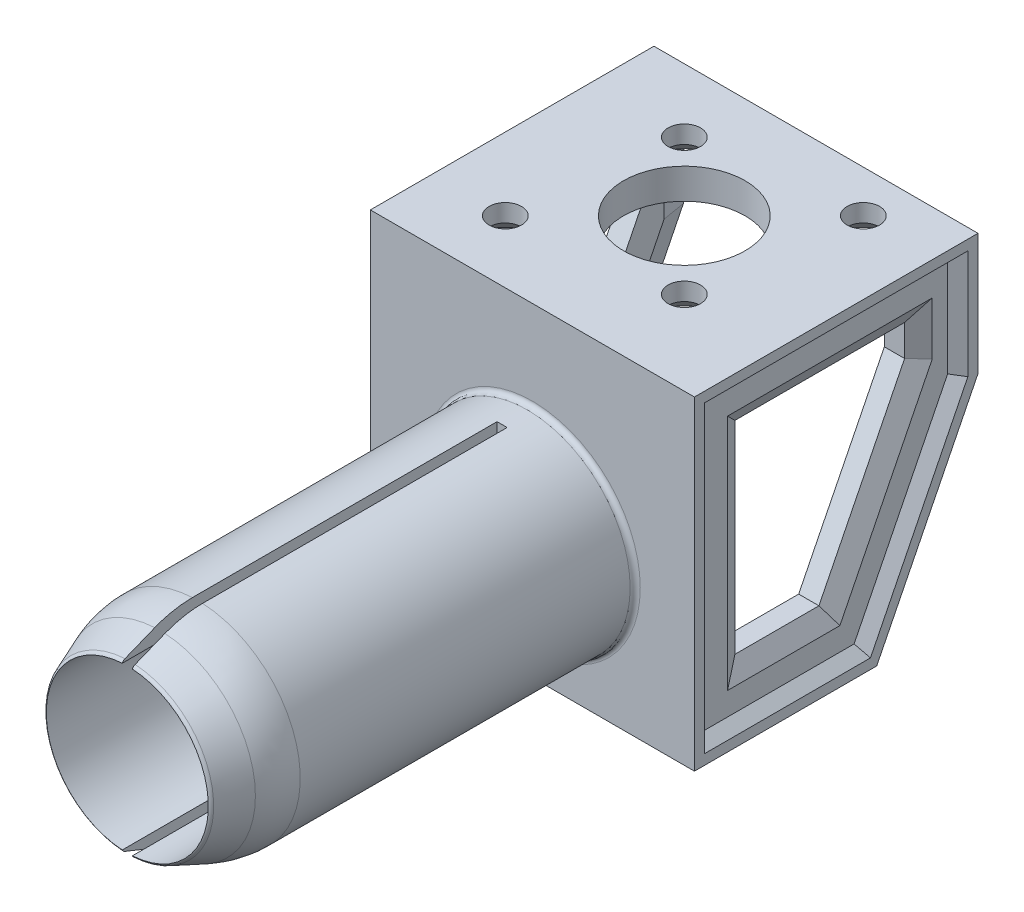
from build123d import *
from OCP.BRepFilletAPI import BRepFilletAPI_MakeChamfer

# Parameters (mm, degrees)
ESQUISSE1_W              = 32
ESQUISSE1_H              = 32
BOSS_EXTRU_1_DEPTH       = 14
CHANFREIN1_SIZE          = 20
CHANFREIN1_SIZE2         = 10
ENL_V_MAT_EXTRU_1_DEPTH  = 1
ESQUISSE11_W             = 12
ESQUISSE11_H             = 29
ENL_V_MAT_EXTRU_4_DEPTH  = 34.7194306
CHANFREIN41_SIZE         = 1
ENL_V_MAT_EXTRU_13_DEPTH = 38.589892258
CHANFREIN63_SIZE         = 1
CHANFREIN63_SIZE2        = 1.732050808
ESQUISSE32_R             = 10.15
ESQUISSE32_R_2           = 8
BOSS_EXTRU_2_DEPTH       = 40
ENL_V_START              = -37
ENL_V_MAT_EXTRU_17_DEPTH = 37
CHANFREIN50_SIZE         = 5
CHANFREIN50_SIZE2        = 2
CONG_4_R                 = 0.5
CONG_5_R                 = 10
CONG_6_R                 = 0.5
ENL_V_MAT_EXTRU_45_REACH = 65.348
ESQUISSE71_R             = 6
ESQUISSE71_R_2           = 1.6
CHANFREIN64_SIZE         = 1.25
CHAMFER1_SIZE            = 3
SKETCH4_R                = 5
CUT_EXTRUDE1_DEPTH       = 46.956501259
FILLET2_R                = 3
CHAMFER2_SIZE            = 3
CHAMFER2_SIZE2           = 1.091910703


# Some blends are built 0.0001 mm under size
with BuildPart() as part:
    # Esquisse1 → Boss.-Extru.1 (new, symmetric)
    with BuildSketch(Plane.XY):
        Rectangle(ESQUISSE1_W, ESQUISSE1_H)
    extrude(amount=BOSS_EXTRU_1_DEPTH, both=True)

    # Chanfrein1
    chanfrein1_edges = [part.edges().sort_by_distance(p)[0] for p in [
        (0, -16, -14),
    ]]
    chanfrein1_side = [part.faces().sort_by_distance(p)[0] for p in [
        (0, 0, -14),
    ]]
    chamfer(chanfrein1_edges, length=CHANFREIN1_SIZE, length2=CHANFREIN1_SIZE2, reference=chanfrein1_side[0])

    # Esquisse5 → Enlèv. mat.-Extru.1 (cut)
    with BuildSketch(Plane.ZY.offset(16)):
        Polygon((-12, 14), (-12, 4.472135955), (-2.763932023, -14), (12, -14), (12, 14), align=None)
    enl_v_mat_extru_1 = extrude(amount=-ENL_V_MAT_EXTRU_1_DEPTH, mode=Mode.SUBTRACT)

    # Symétrie1: Enlèv. mat.-Extru.1 across plane
    add(enl_v_mat_extru_1.mirror(Plane(origin=(0, 0, 0), x_dir=(0, 0, 1), z_dir=(1, 0, 0))), mode=Mode.SUBTRACT)

    # Esquisse11 → Enlèv. mat.-Extru.4 (cut, through all)
    with BuildSketch(Plane.XY.offset(11)):
        with Locations((-6, -1.5)):
            Rectangle(ESQUISSE11_W, ESQUISSE11_H)
        with Locations((6, -1.5)):
            Rectangle(ESQUISSE11_W, ESQUISSE11_H)
    extrude(amount=-ENL_V_MAT_EXTRU_4_DEPTH, mode=Mode.SUBTRACT)

    # Chanfrein41
    chanfrein41_edges = [part.edges().sort_by_distance(p)[0] for p in [
        (16, -4.763932023, -7.381966011),
        (16, 0, 12),
        (16, 14, 0),
        (16, 9.236067977, -12),
        (-16, 0, 12),
        (-16, -4.763932023, -7.381966011),
        (-16, 14, 0),
        (-16, 9.236067977, -12),
        (16, -14, 4.618033989),
        (-16, -14, 4.618033989),
    ]]
    chamfer(chanfrein41_edges, length=CHANFREIN41_SIZE - 0.0001)  # a hair under: the kernel refuses the full size

    # Esquisse24 → Enlèv. mat.-Extru.13 (cut, through all)
    with BuildSketch(Plane.ZY.offset(15)):
        Polygon((-8.75, 6.916407865), (-8.75, 10), (8, 10), (8, -10), (-0.291796068, -10), align=None)
    extrude(amount=-ENL_V_MAT_EXTRU_13_DEPTH, mode=Mode.SUBTRACT)

    # Chanfrein63: one chamfer whose edges measure the first distance from different faces: ONE call of the kernel's chamfer builder (chamfer() names one face for all edges)
    chanfrein63_edges_1 = [part.edges().sort_by_distance(p)[0] for p in [
        (15, 10, -0.375),
    ]]
    chanfrein63_side_1 = [part.faces().sort_by_distance(p)[0] for p in [
        (13.5, 10, -0.375),
    ]]
    chanfrein63_edges_2 = [part.edges().sort_by_distance(p)[0] for p in [
        (15, 0, 8),
    ]]
    chanfrein63_side_2 = [part.faces().sort_by_distance(p)[0] for p in [
        (13.5, 0, 8),
    ]]
    chanfrein63_edges_3 = [part.edges().sort_by_distance(p)[0] for p in [
        (15, -10, 3.854101966),
    ]]
    chanfrein63_side_3 = [part.faces().sort_by_distance(p)[0] for p in [
        (13.5, -10, 3.854101966),
    ]]
    chanfrein63_edges_4 = [part.edges().sort_by_distance(p)[0] for p in [
        (15, -1.541796068, -4.520898034),
    ]]
    chanfrein63_side_4 = [part.faces().sort_by_distance(p)[0] for p in [
        (13.5, -1.541796068, -4.520898034),
    ]]
    chanfrein63_edges_5 = [part.edges().sort_by_distance(p)[0] for p in [
        (15, 8.458203932, -8.75),
    ]]
    chanfrein63_side_5 = [part.faces().sort_by_distance(p)[0] for p in [
        (13.5, 8.458203932, -8.75),
    ]]
    chanfrein63_edges_6 = [part.edges().sort_by_distance(p)[0] for p in [
        (-15, 10, -0.375),
    ]]
    chanfrein63_side_6 = [part.faces().sort_by_distance(p)[0] for p in [
        (-13.5, 10, -0.375),
    ]]
    chanfrein63_edges_7 = [part.edges().sort_by_distance(p)[0] for p in [
        (-15, 8.458203932, -8.75),
    ]]
    chanfrein63_side_7 = [part.faces().sort_by_distance(p)[0] for p in [
        (-13.5, 8.458203932, -8.75),
    ]]
    chanfrein63_edges_8 = [part.edges().sort_by_distance(p)[0] for p in [
        (-15, -1.541796068, -4.520898034),
    ]]
    chanfrein63_side_8 = [part.faces().sort_by_distance(p)[0] for p in [
        (-13.5, -1.541796068, -4.520898034),
    ]]
    chanfrein63_edges_9 = [part.edges().sort_by_distance(p)[0] for p in [
        (-15, -10, 3.854101966),
    ]]
    chanfrein63_side_9 = [part.faces().sort_by_distance(p)[0] for p in [
        (-13.5, -10, 3.854101966),
    ]]
    chanfrein63_edges_10 = [part.edges().sort_by_distance(p)[0] for p in [
        (-15, 0, 8),
    ]]
    chanfrein63_side_10 = [part.faces().sort_by_distance(p)[0] for p in [
        (-13.5, 0, 8),
    ]]
    chanfrein63 = BRepFilletAPI_MakeChamfer(part.part.solid().wrapped)
    for e in chanfrein63_edges_1:
        chanfrein63.Add(CHANFREIN63_SIZE, CHANFREIN63_SIZE2, e.wrapped, chanfrein63_side_1[0].wrapped)  # the first distance lies on this face
    for e in chanfrein63_edges_2:
        chanfrein63.Add(CHANFREIN63_SIZE, CHANFREIN63_SIZE2, e.wrapped, chanfrein63_side_2[0].wrapped)  # the first distance lies on this face
    for e in chanfrein63_edges_3:
        chanfrein63.Add(CHANFREIN63_SIZE, CHANFREIN63_SIZE2, e.wrapped, chanfrein63_side_3[0].wrapped)  # the first distance lies on this face
    for e in chanfrein63_edges_4:
        chanfrein63.Add(CHANFREIN63_SIZE, CHANFREIN63_SIZE2, e.wrapped, chanfrein63_side_4[0].wrapped)  # the first distance lies on this face
    for e in chanfrein63_edges_5:
        chanfrein63.Add(CHANFREIN63_SIZE, CHANFREIN63_SIZE2, e.wrapped, chanfrein63_side_5[0].wrapped)  # the first distance lies on this face
    for e in chanfrein63_edges_6:
        chanfrein63.Add(CHANFREIN63_SIZE, CHANFREIN63_SIZE2, e.wrapped, chanfrein63_side_6[0].wrapped)  # the first distance lies on this face
    for e in chanfrein63_edges_7:
        chanfrein63.Add(CHANFREIN63_SIZE, CHANFREIN63_SIZE2, e.wrapped, chanfrein63_side_7[0].wrapped)  # the first distance lies on this face
    for e in chanfrein63_edges_8:
        chanfrein63.Add(CHANFREIN63_SIZE, CHANFREIN63_SIZE2, e.wrapped, chanfrein63_side_8[0].wrapped)  # the first distance lies on this face
    for e in chanfrein63_edges_9:
        chanfrein63.Add(CHANFREIN63_SIZE, CHANFREIN63_SIZE2, e.wrapped, chanfrein63_side_9[0].wrapped)  # the first distance lies on this face
    for e in chanfrein63_edges_10:
        chanfrein63.Add(CHANFREIN63_SIZE, CHANFREIN63_SIZE2, e.wrapped, chanfrein63_side_10[0].wrapped)  # the first distance lies on this face
    add(Compound.cast(chanfrein63.Shape()), mode=Mode.REPLACE)

    # Esquisse32 → Boss.-Extru.2 (add)
    with BuildSketch(Plane.XY.offset(14)):
        with Locations((0, -3)):
            Circle(ESQUISSE32_R)
        with Locations((0, -3)):
            Circle(ESQUISSE32_R_2, mode=Mode.SUBTRACT)
    extrude(amount=BOSS_EXTRU_2_DEPTH)

    # Esquisse35 → Enlèv. mat.-Extru.17 (cut)
    with BuildSketch(Plane.XY.offset(54).offset(ENL_V_START)):
        with BuildLine():
            ThreePointArc((-0.5, 4.984359711), (0, 5), (0.5, 4.984359711))
            Line((0.5, 4.984359711), (0.5, 7.137677249))
            ThreePointArc((0.5, 7.137677249), (0, 7.15), (-0.5, 7.137677249))
            Line((-0.5, 7.137677249), (-0.5, 4.984359711))
        make_face()
        with BuildLine():
            Line((0.5, -13.137677249), (0.5, -10.984359711))
            ThreePointArc((0.5, -10.984359711), (0, -11), (-0.5, -10.984359711))
            Line((-0.5, -10.984359711), (-0.5, -13.137677249))
            ThreePointArc((-0.5, -13.137677249), (0, -13.15), (0.5, -13.137677249))
        make_face()
    extrude(amount=ENL_V_MAT_EXTRU_17_DEPTH, mode=Mode.SUBTRACT)

    # Chanfrein50
    chanfrein50_edges = [part.edges().sort_by_distance(p)[0] for p in [
        (-10.15, -3, 54),
        (7.351785497, 3.998124749, 54),
    ]]
    chanfrein50_side = [part.faces().sort_by_distance(p)[0] for p in [
        (-10.15, -3, 34),
    ]]
    chamfer(chanfrein50_edges, length=CHANFREIN50_SIZE, length2=CHANFREIN50_SIZE2, reference=chanfrein50_side[0])

    # Congé4
    # the kernel refuses this fillet: 0.5 mm, written as the material it takes off along each edge
    with BuildSketch(Plane(origin=(0, -3, 54), x_dir=(0.02785735277538292, 0.9996119086407224, 0), z_dir=(0.9996119086407224, -0.02785735277538292, 0))) as cong_4_piece_1:
        with BuildLine():
            CenterArc((7.793658453, -0.455437335), CONG_4_R, 21.801409486, 43.825096166)
            Line((8.257896799, -0.269741997), (8.267181566, -0.26602809))
            Line((8.267181566, -0.26602809), (8.159284767, 0.003713907))
            Line((8.159284767, 0.003713907), (8.15, 0.01))
            ThreePointArc((8.15, 0.01), (8.075, 0.01), (8.004126831, 0.009108747))
            Line((8.004126831, 0.009108747), (8, 0))
        make_face()
    revolve(axis=Axis((0, -3, 54), (0, 0, 1)), revolution_arc=183.192630506, mode=Mode.SUBTRACT)
    with BuildSketch(Plane(origin=(0, -3, 54), x_dir=(-0.02785735277538078, 0.9996119086407226, 0), z_dir=(-0.9996119086407226, -0.02785735277538078, 0))) as cong_4_piece_2:
        with BuildLine():
            CenterArc((7.793658453, 0.455437335), CONG_4_R, 294.373494347, 43.825096166)
            Line((8.257896799, 0.269741997), (8.267181566, 0.26602809))
            Line((8.267181566, 0.26602809), (8.159284767, -0.003713907))
            Line((8.159284767, -0.003713907), (8.15, -0.01))
            ThreePointArc((8.15, -0.01), (8.075, -0.01), (8.004126831, -0.009108747))
            Line((8.004126831, -0.009108747), (8, 0))
        make_face()
    revolve(axis=Axis((0, -3, 54), (0, 0, -1)), revolution_arc=183.192630506, mode=Mode.SUBTRACT)

    # Congé5
    cong_5_edges = [part.edges().sort_by_distance(p)[0] for p in [
        (7.351785497, 3.998124749, 49),
        (-10.15, -3, 49),
    ]]
    fillet(cong_5_edges, radius=CONG_5_R)

    # Congé6
    cong_6_edges = [part.edges().sort_by_distance(p)[0] for p in [
        (-10.15, -3, 14),
    ]]
    fillet(cong_6_edges, radius=CONG_6_R)

    # Esquisse71 → Enlèv. mat.-Extru.45 (cut, up to next)
    with BuildSketch(Plane.XZ.offset(-13), mode=Mode.PRIVATE) as enl_v_mat_extru_45_sk1:
        with Locations(Location((0, -1, 0), (0, 0, 270))):
            Circle(ESQUISSE71_R)
    enl_v_mat_extru_45_tool1 = extrude(enl_v_mat_extru_45_sk1.sketch, amount=-ENL_V_MAT_EXTRU_45_REACH, mode=Mode.PRIVATE) & part.part
    # Esquisse71 → Enlèv. mat.-Extru.45 (cut, up to next)
    with BuildSketch(Plane.XZ.offset(-13), mode=Mode.PRIVATE) as enl_v_mat_extru_45_sk2:
        with Locations(Location((8.838834765, -9.838834765, 0), (0, 0, 270))):
            Circle(ESQUISSE71_R_2)
    enl_v_mat_extru_45_tool2 = extrude(enl_v_mat_extru_45_sk2.sketch, amount=-ENL_V_MAT_EXTRU_45_REACH, mode=Mode.PRIVATE) & part.part
    # Esquisse71 → Enlèv. mat.-Extru.45 (cut, up to next)
    with BuildSketch(Plane.XZ.offset(-13), mode=Mode.PRIVATE) as enl_v_mat_extru_45_sk3:
        with Locations(Location((-8.838834765, 7.838834765, 0), (0, 0, 270))):
            Circle(ESQUISSE71_R_2)
    enl_v_mat_extru_45_tool3 = extrude(enl_v_mat_extru_45_sk3.sketch, amount=-ENL_V_MAT_EXTRU_45_REACH, mode=Mode.PRIVATE) & part.part
    # Esquisse71 → Enlèv. mat.-Extru.45 (cut, up to next)
    with BuildSketch(Plane.XZ.offset(-13), mode=Mode.PRIVATE) as enl_v_mat_extru_45_sk4:
        with Locations(Location((-6.717514421, -7.717514421, 0), (0, 0, 270))):
            Circle(ESQUISSE71_R_2)
    enl_v_mat_extru_45_tool4 = extrude(enl_v_mat_extru_45_sk4.sketch, amount=-ENL_V_MAT_EXTRU_45_REACH, mode=Mode.PRIVATE) & part.part
    # Esquisse71 → Enlèv. mat.-Extru.45 (cut, up to next)
    with BuildSketch(Plane.XZ.offset(-13), mode=Mode.PRIVATE) as enl_v_mat_extru_45_sk5:
        with Locations(Location((6.717514421, 5.717514421, 0), (0, 0, 270))):
            Circle(ESQUISSE71_R_2)
    enl_v_mat_extru_45_tool5 = extrude(enl_v_mat_extru_45_sk5.sketch, amount=-ENL_V_MAT_EXTRU_45_REACH, mode=Mode.PRIVATE) & part.part
    add(enl_v_mat_extru_45_tool1.solids().sort_by_distance((0, 13, -1))[0], mode=Mode.SUBTRACT)
    add(enl_v_mat_extru_45_tool2.solids().sort_by_distance((8.838835, 13, -9.838835))[0], mode=Mode.SUBTRACT)
    add(enl_v_mat_extru_45_tool3.solids().sort_by_distance((-8.838835, 13, 7.838835))[0], mode=Mode.SUBTRACT)
    add(enl_v_mat_extru_45_tool4.solids().sort_by_distance((-6.717514, 13, -7.717514))[0], mode=Mode.SUBTRACT)
    add(enl_v_mat_extru_45_tool5.solids().sort_by_distance((6.717514, 13, 5.717514))[0], mode=Mode.SUBTRACT)

    # Chanfrein64
    chanfrein64_edges = [part.edges().sort_by_distance(p)[0] for p in [
        (8.838834765, 13, -8.238834765),
        (-8.838834765, 13, 9.438834765),
        (-6.717514421, 13, -6.117514421),
        (6.717514421, 13, 7.317514421),
    ]]
    chamfer(chanfrein64_edges, length=CHANFREIN64_SIZE)

    # Chamfer1
    chamfer1_edges = [part.edges().sort_by_distance(p)[0] for p in [
        (-8, -3, 14),
    ]]
    chamfer(chamfer1_edges, length=CHAMFER1_SIZE - 0.0001)  # a hair under: the kernel refuses the full size

    # Sketch4 → Cut-Extrude1 (cut, through all)
    with BuildSketch(Plane.XY.offset(14)):
        with Locations((0, -3)):
            Circle(SKETCH4_R)
    extrude(amount=-CUT_EXTRUDE1_DEPTH, mode=Mode.SUBTRACT)

    # Fillet2
    fillet2_edges = [part.edges().sort_by_distance(p)[0] for p in [
        (-5, -3, 11),
    ]]
    fillet(fillet2_edges, radius=FILLET2_R - 0.0001)  # a hair under: the kernel refuses the full size

    # Chamfer2: one chamfer whose edges measure the first distance from different faces: ONE call of the kernel's chamfer builder (chamfer() names one face for all edges)
    chamfer2_edges_1 = [part.edges().sort_by_distance(p)[0] for p in [
        (12, -6, -9),
        (12, -16, 3.5),
        (12, 8.5, -14),
    ]]
    chamfer2_side_1 = [part.faces().sort_by_distance(p)[0] for p in [
        (12, -1.5, 10.617116206),
    ]]
    chamfer2_edges_2 = [part.edges().sort_by_distance(p)[0] for p in [
        (-12, -6, -9),
        (-12, -16, 3.5),
        (-12, 8.5, -14),
    ]]
    chamfer2_side_2 = [part.faces().sort_by_distance(p)[0] for p in [
        (-12, -1.5, 10.617116206),
    ]]
    chamfer2 = BRepFilletAPI_MakeChamfer(part.part.solid().wrapped)
    for e in chamfer2_edges_1:
        chamfer2.Add(CHAMFER2_SIZE, CHAMFER2_SIZE2, e.wrapped, chamfer2_side_1[0].wrapped)  # the first distance lies on this face
    for e in chamfer2_edges_2:
        chamfer2.Add(CHAMFER2_SIZE, CHAMFER2_SIZE2, e.wrapped, chamfer2_side_2[0].wrapped)  # the first distance lies on this face
    add(Compound.cast(chamfer2.Shape()), mode=Mode.REPLACE)


solid = part.part
